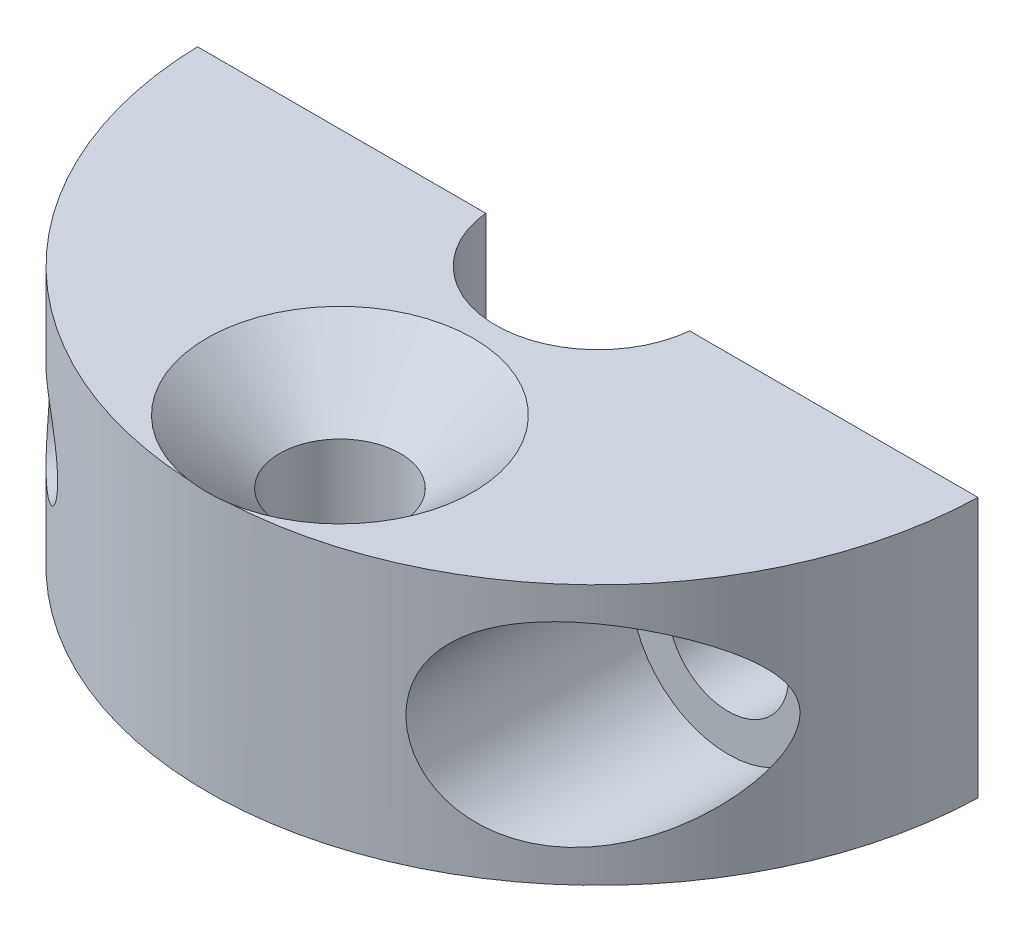
from build123d import *

# Parameters (mm, degrees)
BOSS_EXTRUDE1_DEPTH   = 6.35
F_4_40_TAPPED_HOLE1_D = 2.2606
SKETCH8_R             = 2.38125
CUT_EXTRUDE1_DEPTH    = 6.35
SKETCH9_R             = 1.4732
CUT_EXTRUDE2_DEPTH    = 14.088396137
SKETCH10_R            = 1.4732
CUT_EXTRUDE3_DEPTH    = 15.889903931
CHAMFER1_SIZE         = 1.778
CHAMFER1_SIZE_2       = 1.54559182


with BuildPart() as part:
    # Sketch1 → Boss-Extrude1 (new body)
    with BuildSketch(Plane(origin=(0, 0, 0), x_dir=(1, 0, 0), z_dir=(0, 1, 0))):
        with BuildLine():
            Line((-2.487063329, -0.254), (-9.521612731, -0.254))
            ThreePointArc((-9.521612731, -0.254), (0, -9.525), (9.521612731, -0.254))
            Line((9.521612731, -0.254), (2.487063329, -0.254))
            ThreePointArc((2.487063329, -0.254), (0, -2.5), (-2.487063329, -0.254))
        make_face()
    extrude(amount=BOSS_EXTRUDE1_DEPTH)

    # #4-40 Tapped Hole1 (through all)
    with Locations(Plane(origin=(0, 0, 0.254), x_dir=(-1, 0, 0), z_dir=(0, 0, -1))):
        with Locations((6.35, 3.175)):
            Hole(F_4_40_TAPPED_HOLE1_D / 2)

    # Sketch8 → Cut-Extrude1 (cut)
    with BuildSketch(Plane.XY.offset(9.525)):
        with Locations((6.35, 3.175)):
            Circle(SKETCH8_R)
    extrude(amount=-CUT_EXTRUDE1_DEPTH, mode=Mode.SUBTRACT)

    # Sketch9 → Cut-Extrude2 (cut, through all)
    with BuildSketch(Plane.XY.offset(3.175)):
        with Locations((6.35, 3.175)):
            Circle(SKETCH9_R)
    extrude(amount=-CUT_EXTRUDE2_DEPTH, mode=Mode.SUBTRACT)

    # Sketch10 → Cut-Extrude3 (cut, through all)
    with BuildSketch(Plane(origin=(0, 6.35, 0), x_dir=(1, 0, 0), z_dir=(0, 1, 0))):
        with Locations(Location((0, -6.2992, 0), (0, 0, 270))):
            Circle(SKETCH10_R)
    extrude(amount=-CUT_EXTRUDE3_DEPTH, mode=Mode.SUBTRACT)

    # Chamfer1
    # the kernel refuses this chamfer: 1.778, 1.54559182 mm, written as the material it takes off along each edge
    with BuildSketch(Plane(origin=(0, 6.35, 6.2992), x_dir=(0, 0, 1), z_dir=(-1, 0, 0))) as chamfer1_piece_1:
        Polygon((1.4732 + CHAMFER1_SIZE, 0), (1.4732, -CHAMFER1_SIZE_2), (1.4732, 0), align=None)
    revolve(axis=Axis((0, 6.35, 6.2992), (0, 1, 0)), mode=Mode.SUBTRACT)


solid = part.part
